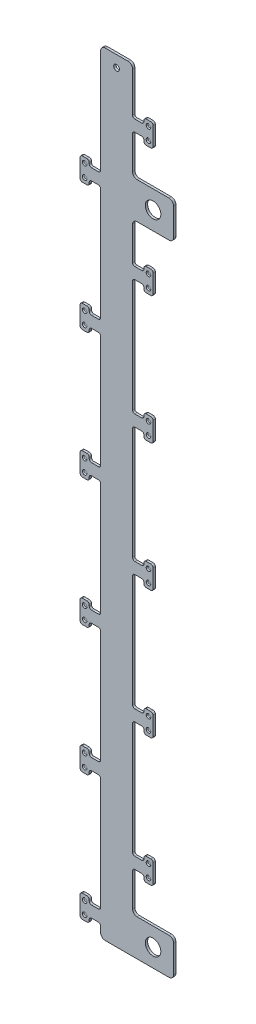
from build123d import *

# Parameters (mm, degrees)
ESQUISSE1_W                      = 7
ESQUISSE1_H                      = 169.5
BOSS_EXTRU_1_DEPTH               = 0.51
ESQUISSE2_R                      = 0.625
ENL_V_MAT_EXTRU_1_DEPTH          = 85.82377379
BOSS_EXTRU_2_DEPTH               = 0.51
CONG_1_R                         = 0.5
ESQUISSE5_R                      = 0.5
BOSS_EXTRU_3_DEPTH               = 0.2
ESQUISSE6_R                      = 0.5
ENL_V_MAT_EXTRU_2_DEPTH          = 0.2
CONG_3_R                         = 0.1
CONG_4_R                         = 0.2
R_P_TITION_LIN_AIRE8_COUNT       = 11
R_P_TITION_LIN_AIRE8_PITCH       = 14
CONG_1_OF_R_P_TITION_LIN_AIRE8_R = 0.5
CONG_3_OF_R_P_TITION_LIN_AIRE8_R = 0.1
CONG_4_OF_R_P_TITION_LIN_AIRE8_R = 0.2
ESQUISSE7_W                      = 9
ESQUISSE7_H                      = 8
ESQUISSE7_R                      = 1.7
BOSS_EXTRU_4_DEPTH               = 0.51
R_P_TITION_LIN_AIRE9_COUNT       = 11
R_P_TITION_LIN_AIRE9_PITCH       = 14
CONG_5_R                         = 1


with BuildPart() as part:
    # Esquisse1 → Boss.-Extru.1 (new body)
    with BuildSketch(Plane.XY):
        Rectangle(ESQUISSE1_W, ESQUISSE1_H)
    extrude(amount=BOSS_EXTRU_1_DEPTH)

    # Esquisse2 → Enlèv. mat.-Extru.1 (cut, through all)
    with BuildSketch(Plane.XY.offset(0.51)):
        with Locations((0, 82.25)):
            Circle(ESQUISSE2_R)
    extrude(amount=-ENL_V_MAT_EXTRU_1_DEPTH, mode=Mode.SUBTRACT)

    # Esquisse4 → Boss.-Extru.2 (add)
    with BuildSketch(Plane.XY.offset(0.51)):
        Polygon((3.5, 74.5), (6, 74.5), (6, 75.75), (8, 75.75), (8, 70.75), (6, 70.75), (6, 72), (3.5, 72), align=None)
        Polygon((-3.5, 58), (-6, 58), (-6, 56.75), (-8, 56.75), (-8, 61.75), (-6, 61.75), (-6, 60.5), (-3.5, 60.5), align=None)
    boss_extru_2 = extrude(amount=-BOSS_EXTRU_2_DEPTH)

    # Congé1
    cong_1_edges = [part.edges().sort_by_distance(p)[0] for p in [
        (6, 72, 0.255),
        (6, 70.75, 0.255),
        (8, 70.75, 0.255),
        (8, 75.75, 0.255),
        (6, 75.75, 0.255),
        (6, 74.5, 0.255),
        (3.5, 74.5, 0.255),
        (3.5, 72, 0.255),
        (-6, 60.5, 0.255),
        (-6, 61.75, 0.255),
        (-8, 61.75, 0.255),
        (-8, 56.75, 0.255),
        (-6, 56.75, 0.255),
        (-6, 58, 0.255),
        (-3.5, 58, 0.255),
        (-3.5, 60.5, 0.255),
    ]]
    fillet(cong_1_edges, radius=CONG_1_R)

    # Esquisse5 → Boss.-Extru.3 (add)
    with BuildSketch(Plane(origin=(0, 0, 0), x_dir=(-1, 0, 0), z_dir=(0, 0, -1))):
        with Locations((-7, 74.6)):
            Circle(ESQUISSE5_R)
        with Locations((-7, 71.9)):
            Circle(ESQUISSE5_R)
        with Locations((7, 60.6)):
            Circle(ESQUISSE5_R)
        with Locations((7, 57.9)):
            Circle(ESQUISSE5_R)
    boss_extru_3 = extrude(amount=BOSS_EXTRU_3_DEPTH)

    # Esquisse6 → Enlèv. mat.-Extru.2 (cut)
    with BuildSketch(Plane.XY.offset(0.51)):
        with Locations(Location((7, 71.9, 0), (0, 0, 180))):
            Circle(ESQUISSE6_R)
        with Locations(Location((7, 74.6, 0), (0, 0, 180))):
            Circle(ESQUISSE6_R)
        with Locations(Location((-7, 57.9, 0), (0, 0, 180))):
            Circle(ESQUISSE6_R)
        with Locations(Location((-7, 60.6, 0), (0, 0, 180))):
            Circle(ESQUISSE6_R)
    enl_v_mat_extru_2 = extrude(amount=-ENL_V_MAT_EXTRU_2_DEPTH, mode=Mode.SUBTRACT)

    # Congé3
    cong_3_edges = [part.edges().sort_by_distance(p)[0] for p in [
        (7.5, 74.6, 0),
        (7.5, 74.6, -0.2),
        (7.5, 71.9, 0),
        (7.5, 71.9, -0.2),
        (-6.5, 60.6, 0),
        (-6.5, 60.6, -0.2),
        (-6.5, 57.9, 0),
        (-6.5, 57.9, -0.2),
    ]]
    fillet(cong_3_edges, radius=CONG_3_R - 0.0001)  # a hair under: the kernel refuses the full size

    # Congé4
    cong_4_edges = [part.edges().sort_by_distance(p)[0] for p in [
        (7.5, 74.6, 0.31),
        (-6.5, 57.9, 0.31),
        (-6.5, 60.6, 0.31),
        (7.5, 71.9, 0.31),
    ]]
    fillet(cong_4_edges, radius=CONG_4_R - 0.0001)  # a hair under: the kernel refuses the full size

    # Répétition linéaire8: Boss.-Extru.2, Boss.-Extru.3, Enlèv. mat.-Extru.2 ×11, 5 skipped
    with Locations(*[(0, -i * R_P_TITION_LIN_AIRE8_PITCH, 0) for i in range(1, R_P_TITION_LIN_AIRE8_COUNT) if i not in (1, 3, 5, 7, 9)]):
        add(boss_extru_2)
        add(boss_extru_3)
        add(enl_v_mat_extru_2, mode=Mode.SUBTRACT)

    # Congé1 of Répétition linéaire8
    cong_1_of_r_p_tition_lin_aire8_edges = [part.edges().sort_by_distance(p)[0] for p in [
        (6, 44, 0.255),
        (6, 42.75, 0.255),
        (8, 42.75, 0.255),
        (8, 47.75, 0.255),
        (6, 47.75, 0.255),
        (6, 46.5, 0.255),
        (3.5, 46.5, 0.255),
        (3.5, 44, 0.255),
        (-6, 32.5, 0.255),
        (-6, 33.75, 0.255),
        (-8, 33.75, 0.255),
        (-8, 28.75, 0.255),
        (-6, 28.75, 0.255),
        (-6, 30, 0.255),
        (-3.5, 30, 0.255),
        (-3.5, 32.5, 0.255),
        (6, 16, 0.255),
        (6, 14.75, 0.255),
        (8, 14.75, 0.255),
        (8, 19.75, 0.255),
        (6, 19.75, 0.255),
        (6, 18.5, 0.255),
        (3.5, 18.5, 0.255),
        (3.5, 16, 0.255),
        (-6, 4.5, 0.255),
        (-6, 5.75, 0.255),
        (-8, 5.75, 0.255),
        (-8, 0.75, 0.255),
        (-6, 0.75, 0.255),
        (-6, 2, 0.255),
        (-3.5, 2, 0.255),
        (-3.5, 4.5, 0.255),
        (6, -12, 0.255),
        (6, -13.25, 0.255),
        (8, -13.25, 0.255),
        (8, -8.25, 0.255),
        (6, -8.25, 0.255),
        (6, -9.5, 0.255),
        (3.5, -9.5, 0.255),
        (3.5, -12, 0.255),
        (-6, -23.5, 0.255),
        (-6, -22.25, 0.255),
        (-8, -22.25, 0.255),
        (-8, -27.25, 0.255),
        (-6, -27.25, 0.255),
        (-6, -26, 0.255),
        (-3.5, -26, 0.255),
        (-3.5, -23.5, 0.255),
        (6, -40, 0.255),
        (6, -41.25, 0.255),
        (8, -41.25, 0.255),
        (8, -36.25, 0.255),
        (6, -36.25, 0.255),
        (6, -37.5, 0.255),
        (3.5, -37.5, 0.255),
        (3.5, -40, 0.255),
        (-6, -51.5, 0.255),
        (-6, -50.25, 0.255),
        (-8, -50.25, 0.255),
        (-8, -55.25, 0.255),
        (-6, -55.25, 0.255),
        (-6, -54, 0.255),
        (-3.5, -54, 0.255),
        (-3.5, -51.5, 0.255),
        (6, -68, 0.255),
        (6, -69.25, 0.255),
        (8, -69.25, 0.255),
        (8, -64.25, 0.255),
        (6, -64.25, 0.255),
        (6, -65.5, 0.255),
        (3.5, -65.5, 0.255),
        (3.5, -68, 0.255),
        (-6, -79.5, 0.255),
        (-6, -78.25, 0.255),
        (-8, -78.25, 0.255),
        (-8, -83.25, 0.255),
        (-6, -83.25, 0.255),
        (-6, -82, 0.255),
        (-3.5, -82, 0.255),
        (-3.5, -79.5, 0.255),
    ]]
    fillet(cong_1_of_r_p_tition_lin_aire8_edges, radius=CONG_1_OF_R_P_TITION_LIN_AIRE8_R)

    # Congé3 of Répétition linéaire8
    cong_3_of_r_p_tition_lin_aire8_edges = [part.edges().sort_by_distance(p)[0] for p in [
        (7.5, 46.6, 0),
        (7.5, 46.6, -0.2),
        (7.5, 43.9, 0),
        (7.5, 43.9, -0.2),
        (-6.5, 32.6, 0),
        (-6.5, 32.6, -0.2),
        (-6.5, 29.9, 0),
        (-6.5, 29.9, -0.2),
        (7.5, 18.6, 0),
        (7.5, 18.6, -0.2),
        (7.5, 15.9, 0),
        (7.5, 15.9, -0.2),
        (-6.5, 4.6, 0),
        (-6.5, 4.6, -0.2),
        (-6.5, 1.9, 0),
        (-6.5, 1.9, -0.2),
        (7.5, -9.4, 0),
        (7.5, -9.4, -0.2),
        (7.5, -12.1, 0),
        (7.5, -12.1, -0.2),
        (-6.5, -23.4, 0),
        (-6.5, -23.4, -0.2),
        (-6.5, -26.1, 0),
        (-6.5, -26.1, -0.2),
        (7.5, -37.4, 0),
        (7.5, -37.4, -0.2),
        (7.5, -40.1, 0),
        (7.5, -40.1, -0.2),
        (-6.5, -51.4, 0),
        (-6.5, -51.4, -0.2),
        (-6.5, -54.1, 0),
        (-6.5, -54.1, -0.2),
        (7.5, -65.4, 0),
        (7.5, -65.4, -0.2),
        (7.5, -68.1, 0),
        (7.5, -68.1, -0.2),
        (-6.5, -79.4, 0),
        (-6.5, -79.4, -0.2),
        (-6.5, -82.1, 0),
        (-6.5, -82.1, -0.2),
    ]]
    fillet(cong_3_of_r_p_tition_lin_aire8_edges, radius=CONG_3_OF_R_P_TITION_LIN_AIRE8_R - 0.0001)  # a hair under: the kernel refuses the full size

    # Congé4 of Répétition linéaire8
    cong_4_of_r_p_tition_lin_aire8_edges = [part.edges().sort_by_distance(p)[0] for p in [
        (7.5, 46.6, 0.31),
        (-6.5, 29.9, 0.31),
        (-6.5, 32.6, 0.31),
        (7.5, 43.9, 0.31),
        (7.5, 18.6, 0.31),
        (-6.5, 1.9, 0.31),
        (-6.5, 4.6, 0.31),
        (7.5, 15.9, 0.31),
        (7.5, -9.4, 0.31),
        (-6.5, -26.1, 0.31),
        (-6.5, -23.4, 0.31),
        (7.5, -12.1, 0.31),
        (7.5, -37.4, 0.31),
        (-6.5, -54.1, 0.31),
        (-6.5, -51.4, 0.31),
        (7.5, -40.1, 0.31),
        (7.5, -65.4, 0.31),
        (-6.5, -82.1, 0.31),
        (-6.5, -79.4, 0.31),
        (7.5, -68.1, 0.31),
    ]]
    fillet(cong_4_of_r_p_tition_lin_aire8_edges, radius=CONG_4_OF_R_P_TITION_LIN_AIRE8_R - 0.0001)  # a hair under: the kernel refuses the full size

    # Esquisse7 → Boss.-Extru.4 (add)
    with BuildSketch(Plane.XY.offset(0.51)):
        with Locations((8, 59.25)):
            Rectangle(ESQUISSE7_W, ESQUISSE7_H)
        with Locations((8, 59.25)):
            Circle(ESQUISSE7_R, mode=Mode.SUBTRACT)
    boss_extru_4 = extrude(amount=-BOSS_EXTRU_4_DEPTH)

    # Répétition linéaire9: Boss.-Extru.4 ×11, 9 skipped
    with Locations(*[(0, -i * R_P_TITION_LIN_AIRE9_PITCH, 0) for i in range(1, R_P_TITION_LIN_AIRE9_COUNT) if i not in (1, 2, 3, 4, 5, 6, 7, 8, 9)]):
        add(boss_extru_4)

    # Congé5
    cong_5_edges = [part.edges().sort_by_distance(p)[0] for p in [
        (3.5, 55.25, 0.255),
        (3.5, 63.25, 0.255),
        (12.5, 63.25, 0.255),
        (12.5, 55.25, 0.255),
        (3.5, -76.75, 0.255),
        (12.5, -76.75, 0.255),
        (12.5, -84.75, 0.255),
        (-3.5, -84.75, 0.255),
        (-3.5, 84.75, 0.255),
        (3.5, 84.75, 0.255),
    ]]
    fillet(cong_5_edges, radius=CONG_5_R)


solid = part.part
